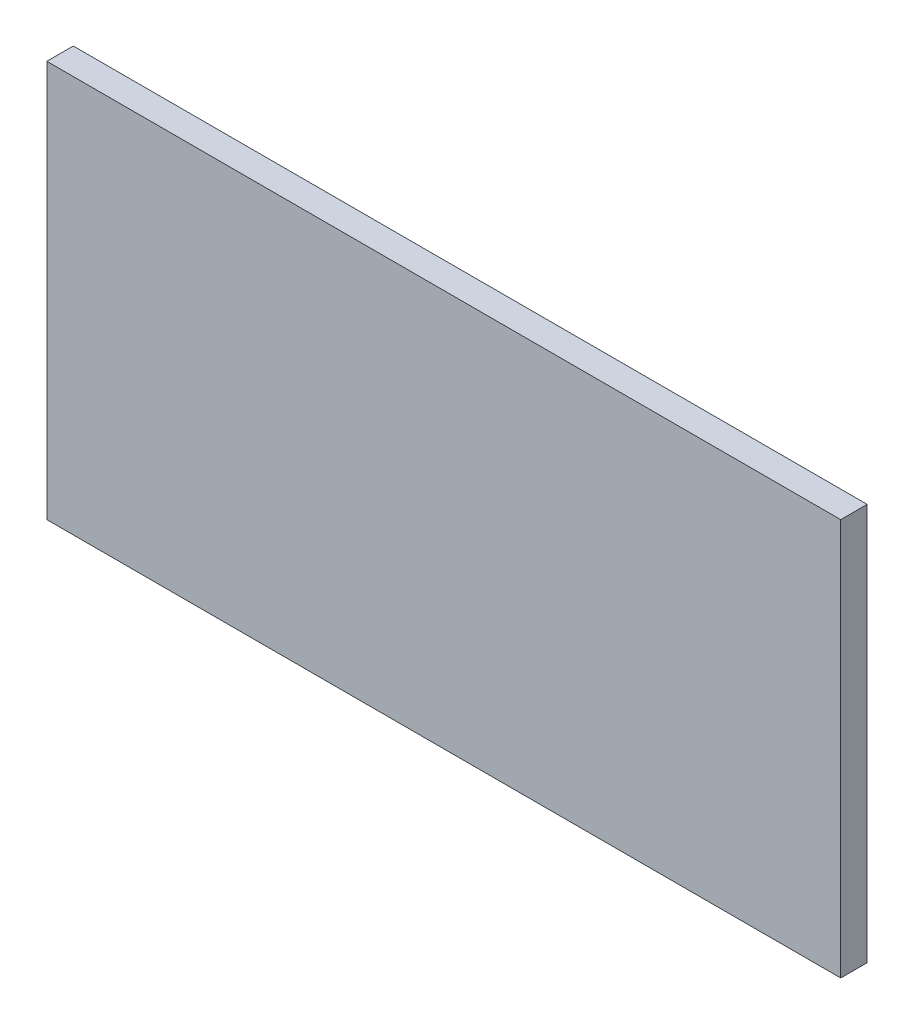
from build123d import *

# Parameters (mm, degrees)
SKETCH_1_W             = 180
SKETCH_1_H             = 90
SM_BASE_FLANGE_1_DEPTH = 6


# Sheet-metal steps are written as plain solids
with BuildPart() as part:
    # Sketch 1 → Базовая кромка1 (new body)
    with BuildSketch(Plane.XY):
        Rectangle(SKETCH_1_W, SKETCH_1_H)
    extrude(amount=-SM_BASE_FLANGE_1_DEPTH)


solid = part.part
